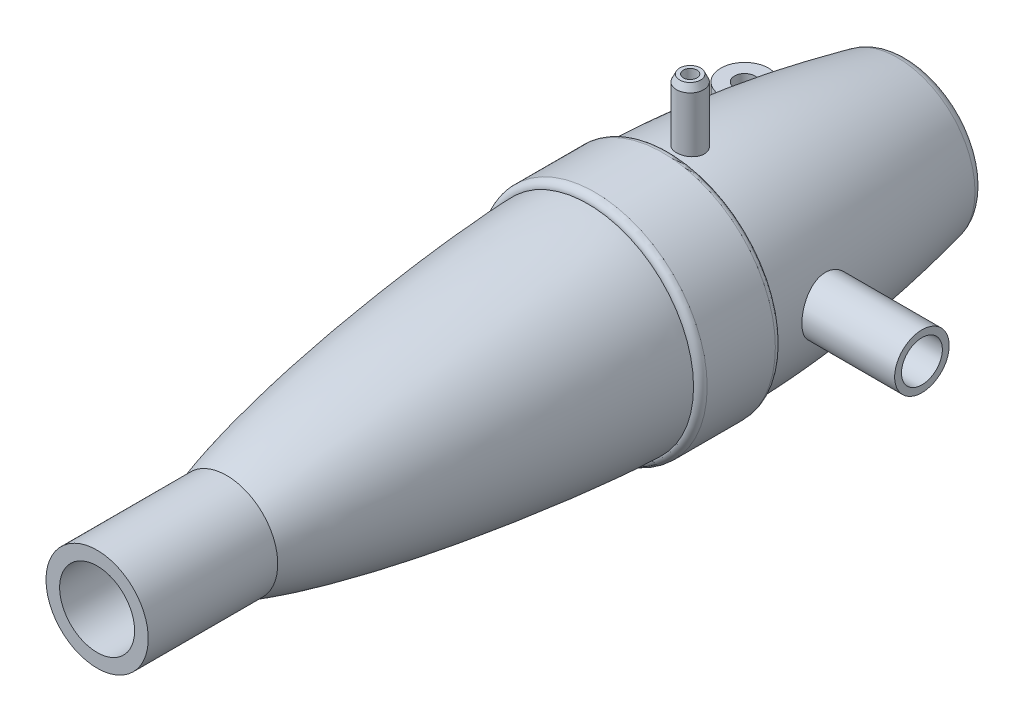
from build123d import *

# Parameters (mm, degrees)
SKETCH1_R                 = 7.5
BOSS_EXTRUDE1_DEPTH       = 19
SKETCH5_R                 = 16.5
SKETCH5_R_2               = 13.5
BOSS_EXTRUDE3_DEPTH       = 12
SKETCH9_R                 = 4
BOSS_EXTRUDE4_DEPTH       = 15
SKETCH10_R                = 2
BOSS_EXTRUDE5_DEPTH       = 11
CHAMFER1_SIZE             = 1
CHAMFER1_SIZE2            = 0.466307658
FILLET1_R                 = 1
FILLET2_R                 = 2
SKETCH15_R                = 5.5
CUT_EXTRUDE1_DEPTH        = 19
SKETCH17_R                = 1
CUT_EXTRUDE2_DEPTH        = 19
SKETCH16_R                = 3
CUT_EXTRUDE3_DEPTH        = 19
BOSS_EXTRUDE9_DEPTH       = 2.5
BOSS_EXTRUDE9_DEPTH_BACK  = 2.5
SKETCH22_R                = 3.5
BOSS_EXTRUDE10_DEPTH      = 2
BOSS_EXTRUDE10_DEPTH_BACK = 2
SKETCH23_W                = 6
SKETCH23_H                = 2
BOSS_EXTRUDE12_DEPTH      = 1
BOSS_EXTRUDE12_DEPTH_BACK = 1
SKETCH26_R                = 1.5
CUT_EXTRUDE5_DEPTH        = 107.418983411


with BuildPart() as part:
    # Sketch1 → Boss-Extrude1 (new body)
    with BuildSketch(Plane.XY):
        Circle(SKETCH1_R)
    extrude(amount=BOSS_EXTRUDE1_DEPTH)

    # Sketch3 → Revolve1 (revolve)
    with BuildSketch(Plane(origin=(0, 0, 0), x_dir=(0, 0, -1), z_dir=(1, 0, 0))):
        with BuildLine():
            Line((0, 7.5), (0, 5.5))
            add(Edge.make_bspline(
                [(0, 5.5), (26.230385201, 13.092629778), (53, 13.5)],
                knots=[0, 0, 0, 0.898157444, 0.898157444, 0.898157444], degree=2))
            Line((53, 13.5), (53, 15.5))
            add(Edge.make_bspline(
                [(0, 7.5), (17.416569759, 13.015671552), (46.915011064, 15.477511864), (53, 15.5)],
                knots=[0, 0, 0, 0, 0.912392447, 0.912392447, 0.912392447, 0.912392447], degree=3))
        make_face()
    revolve(axis=Axis((0, 0, 0), (0, 0, -1)))

    # Sketch5 → Boss-Extrude3 (add)
    with BuildSketch(Plane(origin=(0, 0, -53), x_dir=(-1, 0, 0), z_dir=(0, 0, -1))):
        Circle(SKETCH5_R)
        with Locations(Location((0, 0, 0), (0, 0, 180))):
            Circle(SKETCH5_R_2, mode=Mode.SUBTRACT)
    extrude(amount=BOSS_EXTRUDE3_DEPTH)

    # Sketch8 → Revolve2 (revolve)
    with BuildSketch(Plane(origin=(0, 0, 0), x_dir=(0, 0, -1), z_dir=(1, 0, 0))):
        with BuildLine():
            Line((65, 15.5), (65, 13.5))
            add(Edge.make_bspline(
                [(65, 13.5), (81.806661651, 12.800695989), (98, 9)],
                knots=[0, 0, 0, 0.795332907, 0.795332907, 0.795332907], degree=2))
            Line((98, 9), (98, 0))
            Line((98, 0), (100, 0))
            Line((100, 0), (100, 11))
            add(Edge.make_bspline(
                [(65, 15.5), (78.626944165, 15.326525568), (90.89296342, 13.101726586), (100, 11)],
                knots=[0, 0, 0, 0, 0.876068459, 0.876068459, 0.876068459, 0.876068459], degree=3))
        make_face()
    revolve(axis=Axis((0, 0, -65), (0, 0, -1)))

    # Sketch9 → Boss-Extrude4 (add)
    with BuildSketch(Plane(origin=(29, 0, 0), x_dir=(0, 0, -1), z_dir=(1, 0, 0))):
        with Locations((73, 0)):
            Circle(SKETCH9_R)
    extrude(amount=-BOSS_EXTRUDE4_DEPTH)

    # Sketch10 → Boss-Extrude5 (add)
    with BuildSketch(Plane(origin=(0, 24.5, 0), x_dir=(1, 0, 0), z_dir=(0, 1, 0))):
        with Locations(Location((0, 68, 0), (0, 0, 270))):
            Circle(SKETCH10_R)
    extrude(amount=-BOSS_EXTRUDE5_DEPTH)

    # Chamfer1
    chamfer1_edges = [part.edges().sort_by_distance(p)[0] for p in [
        (0, 24.5, -70),
    ]]
    chamfer1_side = [part.faces().sort_by_distance(p)[0] for p in [
        (0, 19.893621866, -70),
    ]]
    chamfer(chamfer1_edges, length=CHAMFER1_SIZE, length2=CHAMFER1_SIZE2, reference=chamfer1_side[0])

    # Fillet1
    fillet1_edges = [part.edges().sort_by_distance(p)[0] for p in [
        (16.5, 0, -65),
        (16.5, 0, -53),
    ]]
    fillet(fillet1_edges, radius=FILLET1_R - 0.0001)  # a hair under: the kernel refuses the full size

    # Fillet2
    fillet2_edges = [part.edges().sort_by_distance(p)[0] for p in [
        (0, -11, -100),
    ]]
    fillet(fillet2_edges, radius=FILLET2_R)

    # Sketch15 → Cut-Extrude1 (cut)
    with BuildSketch(Plane.XY.offset(19)):
        Circle(SKETCH15_R)
    extrude(amount=-CUT_EXTRUDE1_DEPTH, mode=Mode.SUBTRACT)

    # Sketch17 → Cut-Extrude2 (cut)
    with BuildSketch(Plane(origin=(0, 24.5, 0), x_dir=(1, 0, 0), z_dir=(0, 1, 0))):
        with Locations(Location((0, 68, 0), (0, 0, 270))):
            Circle(SKETCH17_R)
    extrude(amount=-CUT_EXTRUDE2_DEPTH, mode=Mode.SUBTRACT)

    # Sketch16 → Cut-Extrude3 (cut)
    with BuildSketch(Plane(origin=(29, 0, 0), x_dir=(0, 0, -1), z_dir=(1, 0, 0))):
        with Locations((73, 0)):
            Circle(SKETCH16_R)
    extrude(amount=-CUT_EXTRUDE3_DEPTH, mode=Mode.SUBTRACT)



with BuildPart() as body_2:
    # Sketch22 → Boss-Extrude9 (new, two sides: drawn at the far end of the back side and taken through both)
    with BuildSketch(Plane(origin=(0, 0, 0), x_dir=(1, 0, 0), z_dir=(0, 1, 0)).offset(-BOSS_EXTRUDE9_DEPTH_BACK)):
        with Locations(Location((-17, 93, 0), (0, 0, 270))):
            Circle(SKETCH22_R)
    extrude(amount=BOSS_EXTRUDE9_DEPTH + BOSS_EXTRUDE9_DEPTH_BACK)


with BuildPart() as part_1:
    add(part.part)

    add(body_2.part)  # Boss-Extrude10 merges body 2
    # Sketch23 → Boss-Extrude10 (add, two sides: drawn at the far end of the back side and taken through both)
    with BuildSketch(Plane(origin=(0, 0, 0), x_dir=(1, 0, 0), z_dir=(0, 1, 0)).offset(-BOSS_EXTRUDE10_DEPTH_BACK)):
        with Locations((-14, 93)):
            Rectangle(SKETCH23_W, SKETCH23_H)
    extrude(amount=BOSS_EXTRUDE10_DEPTH + BOSS_EXTRUDE10_DEPTH_BACK)

    # Sketch25 → Boss-Extrude12 (add, two sides: drawn at the far end of the back side and taken through both)
    with BuildSketch(Plane(origin=(0, 0, 0), x_dir=(1, 0, 0), z_dir=(0, 1, 0)).offset(-BOSS_EXTRUDE12_DEPTH_BACK)):
        Polygon((-17, 96.5), (-10.626707162, 97.623783483), (-11.936536901, 88.60717484), (-17, 89.5), align=None)
    extrude(amount=BOSS_EXTRUDE12_DEPTH + BOSS_EXTRUDE12_DEPTH_BACK)

    # Sketch26 → Cut-Extrude5 (cut, through all)
    with BuildSketch(Plane(origin=(0, 2.5, 0), x_dir=(1, 0, 0), z_dir=(0, 1, 0))):
        with Locations(Location((-17, 93, 0), (0, 0, 270))):
            Circle(SKETCH26_R)
    extrude(amount=-CUT_EXTRUDE5_DEPTH, mode=Mode.SUBTRACT)


solid = part_1.part
